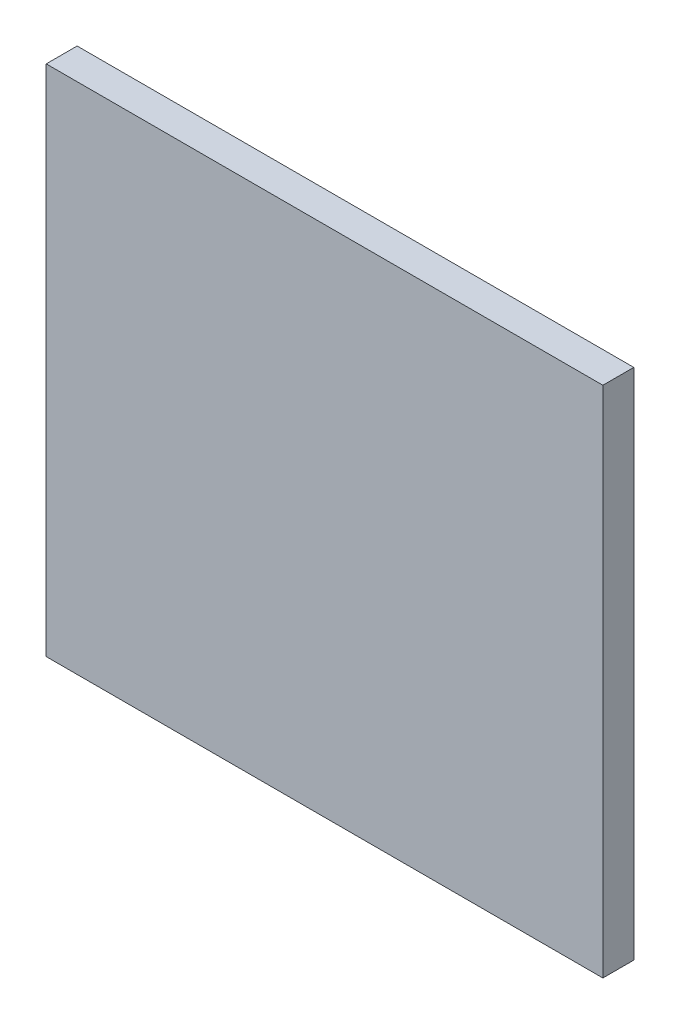
from build123d import *

# Parameters (mm, degrees)
SKETCH1_W           = 90
SKETCH1_H           = 83
BOSS_EXTRUDE1_DEPTH = 5


with BuildPart() as part:
    # Sketch1 → Boss-Extrude1 (new body)
    with BuildSketch(Plane.XY):
        Rectangle(SKETCH1_W, SKETCH1_H)
    extrude(amount=BOSS_EXTRUDE1_DEPTH)


solid = part.part
